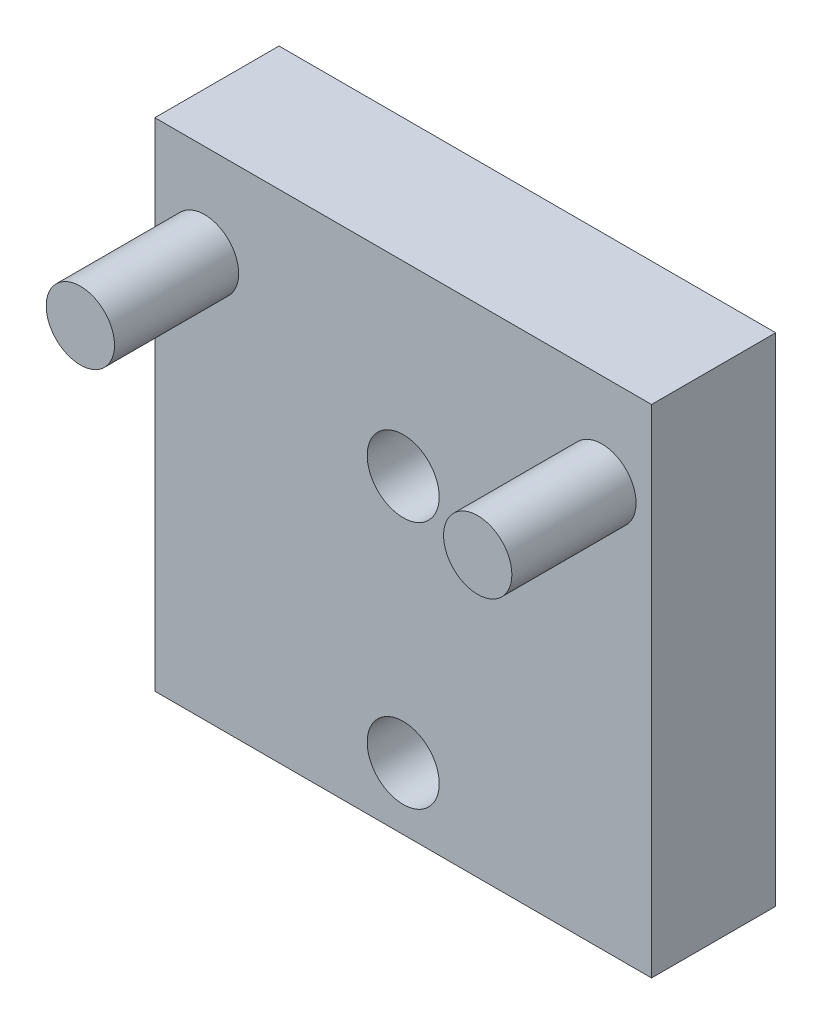
from build123d import *

# Parameters (mm, degrees)
SKETCH1_W            = 40
SKETCH1_H            = 15
BOSS_EXTRUDE1_DEPTH  = 10
SKETCH2_R            = 2.75
BOSS_EXTRUDE2_DEPTH  = 10
SKETCH3_W            = 40
SKETCH3_H            = 25
BOSS_EXTRUDE3_DEPTH  = 10
M5_CLEARANCE_HOLE1_D = 5.8


with BuildPart() as part:
    # Sketch1 → Boss-Extrude1 (new body)
    with BuildSketch(Plane.XY):
        Rectangle(SKETCH1_W, SKETCH1_H)
    extrude(amount=-BOSS_EXTRUDE1_DEPTH)

    # Sketch2 → Boss-Extrude2 (add)
    with BuildSketch(Plane.XY):
        with Locations((-16, 0)):
            Circle(SKETCH2_R)
        with Locations((16, 0)):
            Circle(SKETCH2_R)
    extrude(amount=BOSS_EXTRUDE2_DEPTH)

    # Sketch3 → Boss-Extrude3 (add)
    with BuildSketch(Plane.XY):
        with Locations((0, -20)):
            Rectangle(SKETCH3_W, SKETCH3_H)
    extrude(amount=-BOSS_EXTRUDE3_DEPTH)

    # M5 Clearance Hole1 (through all)
    with Locations(Plane.XY):
        with Locations((0, -7.5), (0, -27.5)):
            Hole(M5_CLEARANCE_HOLE1_D / 2)


solid = part.part
